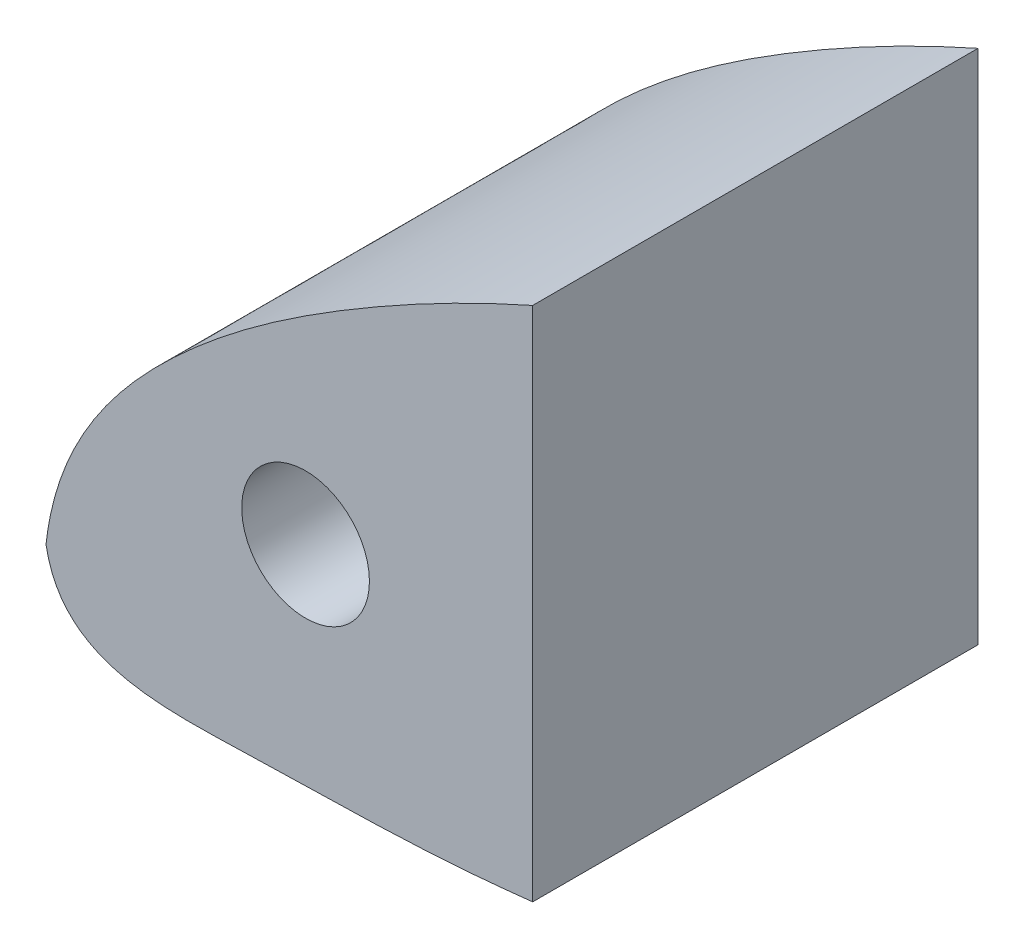
from build123d import *

# Parameters (mm, degrees)
BOSS_EXTRUDE1_DEPTH = 34.8615
SKETCH2_R           = 5
SKETCH2_R_2         = 3.175
CUT_EXTRUDE1_DEPTH  = 318.646799811
SKETCH3_W           = 293.188888759
SKETCH3_H           = 137.971241769
CUT_EXTRUDE2_DEPTH  = 318.646799811


with BuildPart() as part:
    # Sketch1 → Boss-Extrude1 (new body)
    with BuildSketch(Plane.XY):
        with BuildLine():
            add(Edge.make_bspline(
                [(0.000560351, 0.000130087), (0.810633127, 7.359196055), (8.649092025, 17.856605174), (26.286719818, 29.975176328), (52.111128271, 42.069215275), (89.597618475, 49.290763054), (131.400792109, 47.884831915), (173.256699242, 40.041104278), (217.961060472, 29.612974894), (256.952064401, 19.528920948), (290.35983767, 8.71099439), (301.273197721, 4.382828139), (314.816918223, -0.516206742), (309.846313895, 0.000130087)],
                knots=[0, 0, 0, 0, 0.060863618, 0.113688265, 0.188608742, 0.312908923, 0.448482434, 0.557612135, 0.691544113, 0.852438279, 0.92975597, 0.976058229, 1, 1, 1, 1], degree=3))
            add(Edge.make_bspline(
                [(309.846313895, 0.000130087), (303.956832565, 1.47095521), (293.989507544, 2.093987313), (276.26402299, 4.514356704), (260.846344817, 5.427413394), (235.858814759, 7.870306192), (205.101424636, 8.838080282), (157.718638092, 9.030650149), (110.497331172, 6.181495223), (66.506197185, -0.586669107), (36.454672816, -6.098499901), (15.316603331, -6.189065841), (1.230714189, -6.924076091), (0.000560351, 0.000130087)],
                knots=[0, 0, 0, 0, 0.057787081, 0.095274891, 0.171021118, 0.205339302, 0.335319146, 0.464904334, 0.658702312, 0.785511947, 0.893517288, 0.94309214, 1, 1, 1, 1], degree=3))
        make_face()
    extrude(amount=BOSS_EXTRUDE1_DEPTH)

    # Sketch2 → Cut-Extrude1 (cut, through all)
    with BuildSketch(Plane.XY.offset(34.8615)):
        with Locations((20.32, 10.16)):
            Circle(SKETCH2_R)
        with Locations((227.296313895, 19.050130087)):
            Circle(SKETCH2_R_2)
    extrude(amount=-CUT_EXTRUDE1_DEPTH, mode=Mode.SUBTRACT)

    # Sketch3 → Cut-Extrude2 (cut, through all)
    with BuildSketch(Plane.XY.offset(34.8615)):
        with Locations((184.69444438, 2.732377951)):
            Rectangle(SKETCH3_W, SKETCH3_H)
    extrude(amount=-CUT_EXTRUDE2_DEPTH, mode=Mode.SUBTRACT)


solid = part.part
